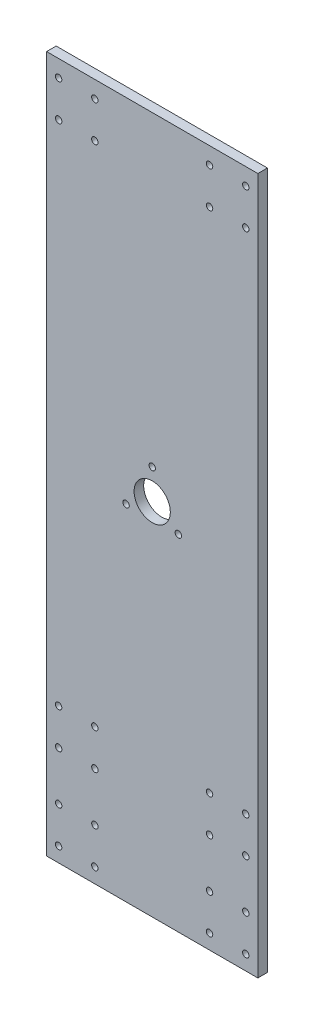
from build123d import *

# Parameters (mm, degrees)
SKETCH1_W           = 140
SKETCH1_H           = 461.65
SKETCH1_R           = 2.125
BOSS_EXTRUDE1_DEPTH = 6.35
SKETCH2_R           = 12
SKETCH2_R_2         = 2.125
CUT_EXTRUDE1_DEPTH  = 242.289251988


with BuildPart() as part:
    # Sketch1 → Boss-Extrude1 (new body)
    with BuildSketch(Plane.XY):
        Rectangle(SKETCH1_W, SKETCH1_H)
        with Locations((-62, 219.65)):
            Circle(SKETCH1_R, mode=Mode.SUBTRACT)
        with Locations((-38, 219.65)):
            Circle(SKETCH1_R, mode=Mode.SUBTRACT)
        with Locations((-38, 195.65)):
            Circle(SKETCH1_R, mode=Mode.SUBTRACT)
        with Locations((-62, 195.65)):
            Circle(SKETCH1_R, mode=Mode.SUBTRACT)
        with Locations((38, 195.65)):
            Circle(SKETCH1_R, mode=Mode.SUBTRACT)
        with Locations((62, 195.65)):
            Circle(SKETCH1_R, mode=Mode.SUBTRACT)
        with Locations((38, 219.65)):
            Circle(SKETCH1_R, mode=Mode.SUBTRACT)
        with Locations((62, 219.65)):
            Circle(SKETCH1_R, mode=Mode.SUBTRACT)
        with Locations((62, -164.7)):
            Circle(SKETCH1_R, mode=Mode.SUBTRACT)
        with Locations((38, -164.7)):
            Circle(SKETCH1_R, mode=Mode.SUBTRACT)
        with Locations((62, -140.7)):
            Circle(SKETCH1_R, mode=Mode.SUBTRACT)
        with Locations((38, -140.7)):
            Circle(SKETCH1_R, mode=Mode.SUBTRACT)
        with Locations((-62, -140.7)):
            Circle(SKETCH1_R, mode=Mode.SUBTRACT)
        with Locations((-38, -140.7)):
            Circle(SKETCH1_R, mode=Mode.SUBTRACT)
        with Locations((-38, -164.7)):
            Circle(SKETCH1_R, mode=Mode.SUBTRACT)
        with Locations((-62, -164.7)):
            Circle(SKETCH1_R, mode=Mode.SUBTRACT)
        with Locations((-62, -197.05)):
            Circle(SKETCH1_R, mode=Mode.SUBTRACT)
        with Locations((-38, -197.05)):
            Circle(SKETCH1_R, mode=Mode.SUBTRACT)
        with Locations((-38, -221.05)):
            Circle(SKETCH1_R, mode=Mode.SUBTRACT)
        with Locations((-62, -221.05)):
            Circle(SKETCH1_R, mode=Mode.SUBTRACT)
        with Locations((38, -221.05)):
            Circle(SKETCH1_R, mode=Mode.SUBTRACT)
        with Locations((62, -221.05)):
            Circle(SKETCH1_R, mode=Mode.SUBTRACT)
        with Locations((38, -197.05)):
            Circle(SKETCH1_R, mode=Mode.SUBTRACT)
        with Locations((62, -197.05)):
            Circle(SKETCH1_R, mode=Mode.SUBTRACT)
    extrude(amount=BOSS_EXTRUDE1_DEPTH)

    # Sketch2 → Cut-Extrude1 (cut, through all)
    with BuildSketch(Plane.XY.offset(6.35)):
        with Locations((0, 7.475)):
            Circle(SKETCH2_R)
        with Locations((0, 27.475)):
            Circle(SKETCH2_R_2)
        with Locations((17.320508076, -2.525)):
            Circle(SKETCH2_R_2)
        with Locations((-17.320508076, -2.525)):
            Circle(SKETCH2_R_2)
    extrude(amount=-CUT_EXTRUDE1_DEPTH, mode=Mode.SUBTRACT)


solid = part.part
